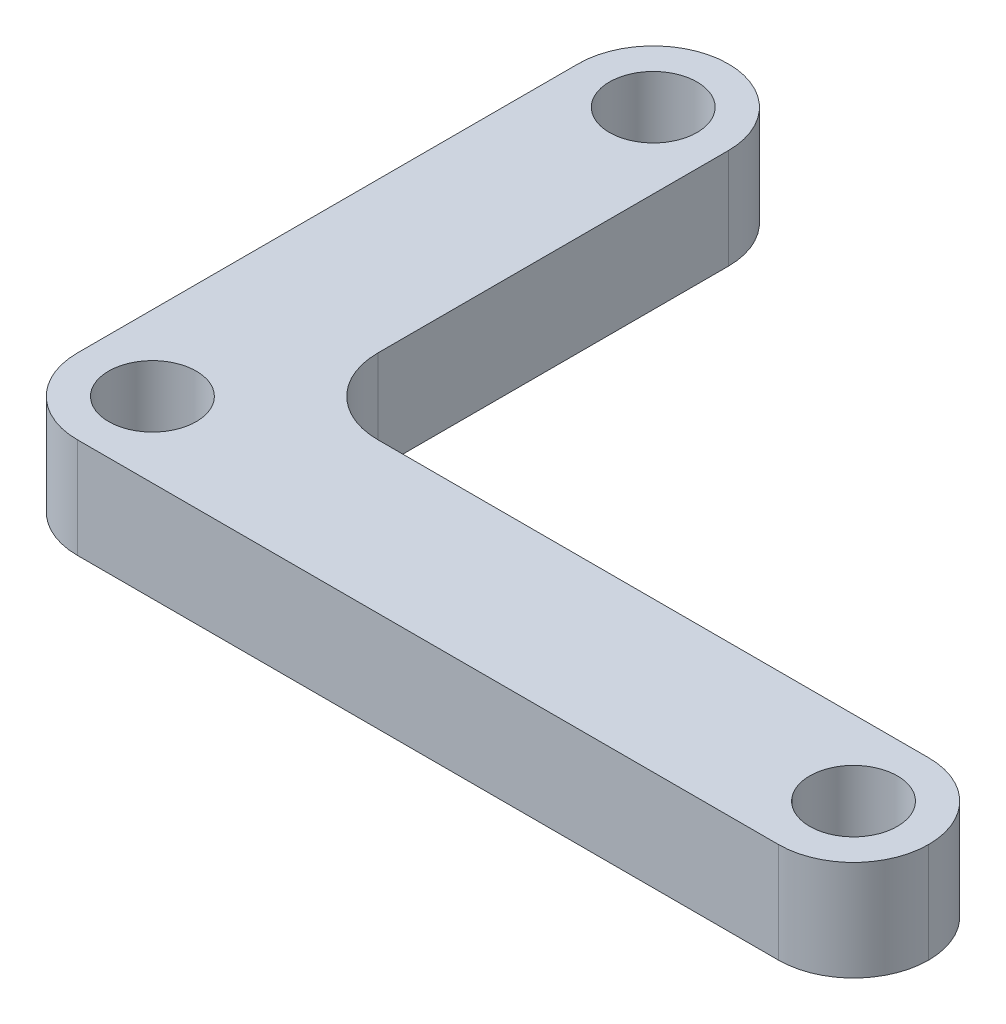
from build123d import *

# Parameters (mm, degrees)
CROQUIS1_R              = 1.75
SALIENTE_EXTRUIR1_DEPTH = 4
REDONDEO1_R             = 3


with BuildPart() as part:
    # Croquis1 → Saliente-Extruir1 (new body)
    with BuildSketch(Plane(origin=(0, 0, 0), x_dir=(1, 0, 0), z_dir=(0, 1, 0))):
        Polygon((0, 0), (0, 26), (6, 26), (6, 6), (34, 6), (34, 0), align=None)
        with Locations(Location((3, 23, 0), (0, 0, 270))):
            Circle(CROQUIS1_R, mode=Mode.SUBTRACT)
        with Locations(Location((31, 3, 0), (0, 0, 270))):
            Circle(CROQUIS1_R, mode=Mode.SUBTRACT)
        with Locations(Location((3, 3, 0), (0, 0, 270))):
            Circle(CROQUIS1_R, mode=Mode.SUBTRACT)
    extrude(amount=SALIENTE_EXTRUIR1_DEPTH)

    # Redondeo1
    redondeo1_edges = [part.edges().sort_by_distance(p)[0] for p in [
        (6, 2, -6),
        (0, 2, 0),
        (0, 2, -26),
        (6, 2, -26),
        (34, 2, -6),
        (34, 2, 0),
    ]]
    fillet(redondeo1_edges, radius=REDONDEO1_R - 0.0001)  # a hair under: the kernel refuses the full size


solid = part.part
